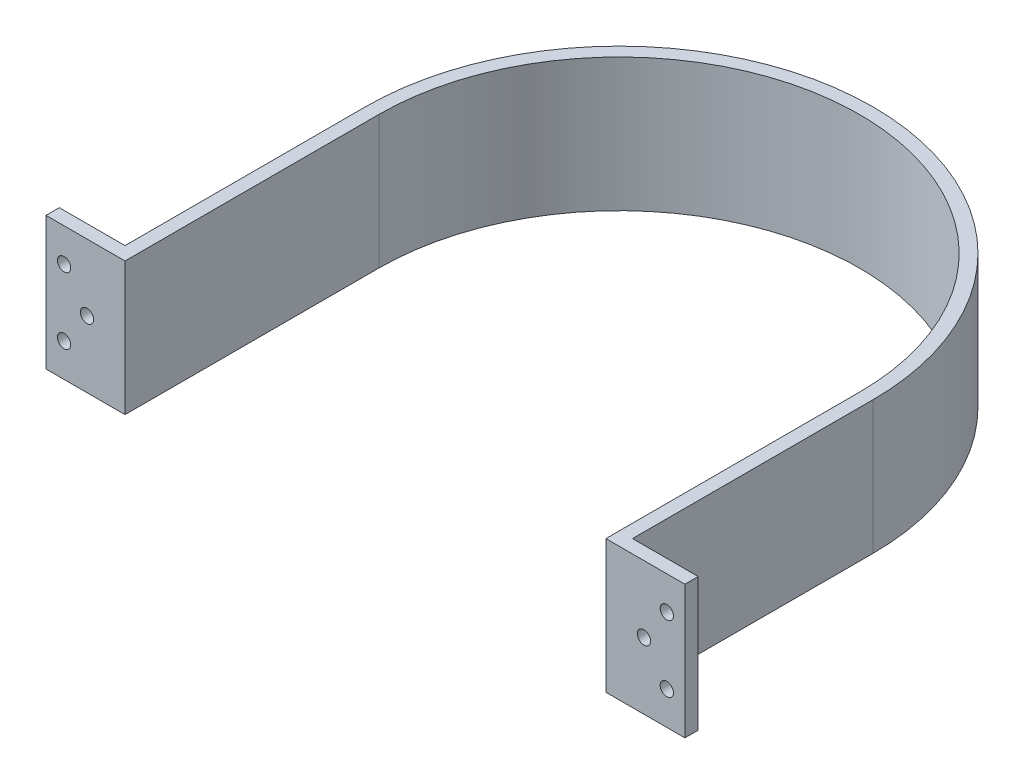
from build123d import *

# Parameters (mm, degrees)
BOSS_EXTRUDE1_DEPTH = 31.75
SKETCH15_R          = 3.175
CUT_EXTRUDE1_DEPTH  = 288.83021471


with BuildPart() as part:
    # Sketch1 → Boss-Extrude1 (new, symmetric)
    with BuildSketch(Plane(origin=(0, 0, 0), x_dir=(1, 0, 0), z_dir=(0, 1, 0))):
        with BuildLine():
            Line((-114.7, -121.05), (-114.7, 0))
            ThreePointArc((-114.7, 0), (0, 114.7), (114.7, 0))
            Line((114.7, 0), (114.7, -121.05))
            Line((114.7, -121.05), (152.4, -121.05))
            Line((152.4, -121.05), (152.4, -114.7))
            Line((152.4, -114.7), (121.05, -114.7))
            Line((121.05, -114.7), (121.05, 0))
            ThreePointArc((121.05, 0), (0, 121.05), (-121.05, 0))
            Line((-121.05, 0), (-121.05, -12.7))
            Line((-121.05, -12.7), (-121.05, -114.7))
            Line((-121.05, -114.7), (-152.4, -114.7))
            Line((-152.4, -114.7), (-152.4, -121.05))
            Line((-152.4, -121.05), (-114.7, -121.05))
        make_face()
    extrude(amount=BOSS_EXTRUDE1_DEPTH, both=True)

    # Sketch15 → Cut-Extrude1 (cut, through all)
    with BuildSketch(Plane.XY.offset(121.05)):
        with Locations((-143.76875, 15.875)):
            Circle(SKETCH15_R)
        with Locations((-143.76875, -15.875)):
            Circle(SKETCH15_R)
        with Locations((-132.85625, 0)):
            Circle(SKETCH15_R)
        with Locations((132.85625, 0)):
            Circle(SKETCH15_R)
        with Locations((143.76875, -15.875)):
            Circle(SKETCH15_R)
        with Locations((143.76875, 15.875)):
            Circle(SKETCH15_R)
    extrude(amount=-CUT_EXTRUDE1_DEPTH, mode=Mode.SUBTRACT)


solid = part.part
